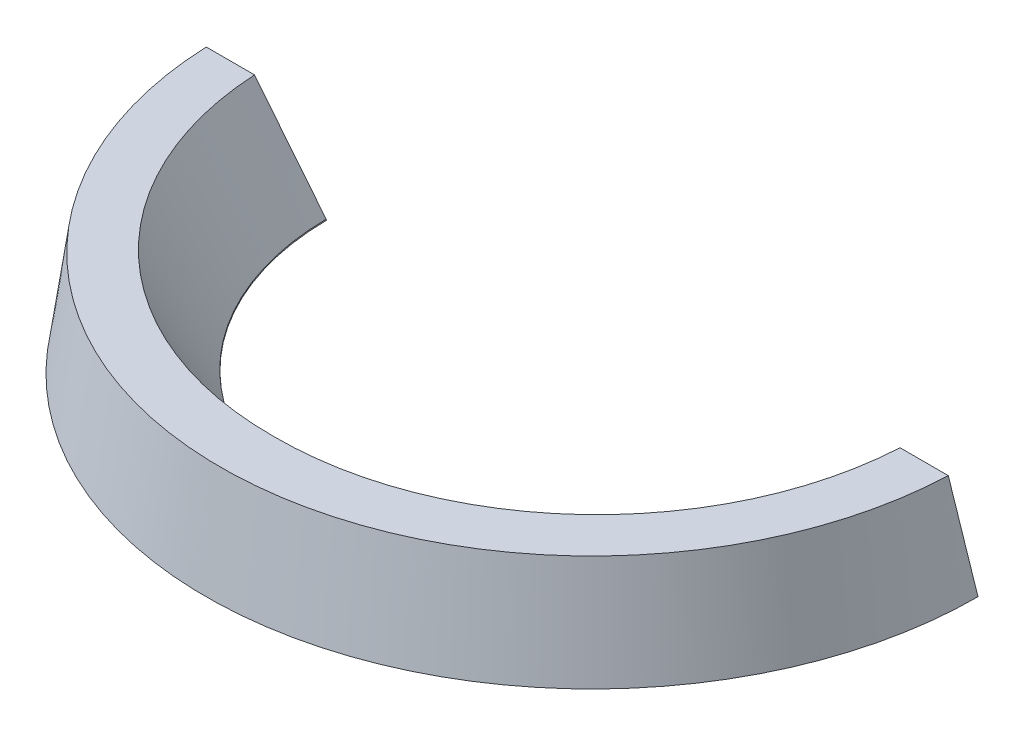
from build123d import *

# Parameters (mm, degrees)
BOSS_EXTRUDE1_DEPTH = 10
BOSS_EXTRUDE1_DRAFT = 8


with BuildPart() as part:
    # Sketch1 → Boss-Extrude1 (with draft: the straight prism first)
    with BuildSketch(Plane(origin=(0, 0, 0), x_dir=(1, 0, 0), z_dir=(0, 1, 0))):
        with BuildLine():
            Line((36.892843318, -6.916769299), (25.392844844, -6.907371064))
            ThreePointArc((25.392844844, -6.907371064), (17.862146893, -24.595305322), (0.029881046, -31.777555993))
            ThreePointArc((0.029881046, -31.777555993), (-17.799721033, -24.588695191), (-25.323861346, -6.897970432))
            Line((-25.323861346, -6.897970432), (-36.823861346, -6.897970432))
            ThreePointArc((-36.823861346, -6.897970432), (0.025091553, -43.765722197), (36.892843318, -6.916769299))
        make_face()
    extrude(amount=BOSS_EXTRUDE1_DEPTH)
    # Boss-Extrude1: the draft: its side faces are tilted about the plane it starts from
    boss_extrude1_sides = [part.faces().sort_by_distance(p)[0] for p in [
        (31.142844081, 5, 6.912070181),
        (17.862146893, 5, 24.595305322),
        (-17.799721033, 5, 24.588695191),
        (-31.073861346, 5, 6.897970432),
        (0.025091553, 5, 43.765722197),
    ]]
    draft(boss_extrude1_sides, Plane(origin=(0, 0, 0), x_dir=(1, 0, 0), z_dir=(0, 1, 0)), BOSS_EXTRUDE1_DRAFT)

    # Chamfer3: read off the stored shape, not the designer's step
    # Chamfer3 outline → Chamfer3 (revolve, cut)
    with BuildSketch(Plane(origin=(-0.207197369, 0, 6.660892016), x_dir=(1, 0, 0), z_dir=(0, 0, 1))):
        Polygon((25.131460191, 10), (25.131460191, 0.097319313), (30.62060573, 10), align=None)
    revolve(axis=Axis((-0.207197369, 0, 6.660892016), (0, 1, 0)), mode=Mode.SUBTRACT)

    # Chamfer3 2 outline → Chamfer3 2 (revolve, cut)
    with BuildSketch(Plane(origin=(0.27627048, 0, 6.66098163), x_dir=(1, 0, 0), z_dir=(0, 0, 1))):
        Polygon((25.295653078, 1.265612408), (25.131460191, 0.097319313), (30.62060573, 10), (25.295653078, 10), align=None)
    revolve(axis=Axis((0.27627048, 0, 6.66098163), (0, 1, 0)), mode=Mode.SUBTRACT)


solid = part.part
